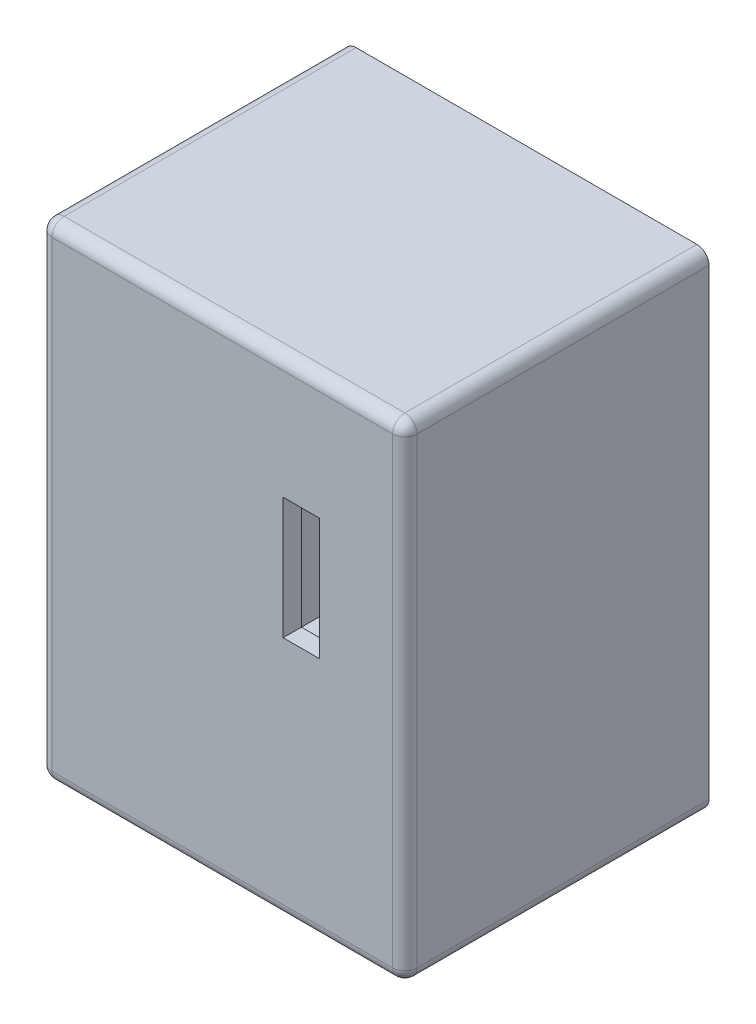
from build123d import *

# Parameters (mm, degrees)
SKETCH2_W           = 30
SKETCH2_H           = 40
BOSS_EXTRUDE2_DEPTH = 25
FILLET2_R           = 1
FILLET3_R           = 1
SHELL1_START        = 1.5
SHELL1_OUTLINE_W    = 37
SHELL1_OUTLINE_H    = 23.5
SHELL1_DEPTH        = 27
FILLET4_R           = 1
SKETCH5_W           = 3
SKETCH5_H           = 10
CUT_EXTRUDE1_DEPTH  = 56.901699437


# Read off the part's stored shape, not the designer's step: Shell1
with BuildPart() as part:
    # Sketch2 → Boss-Extrude2 (new body)
    with BuildSketch(Plane.XY):
        with Locations((15, 20)):
            Rectangle(SKETCH2_W, SKETCH2_H)
    extrude(amount=BOSS_EXTRUDE2_DEPTH)

    # Fillet2
    fillet2_edges = [part.edges().sort_by_distance(p)[0] for p in [
        (30, 20, 25),
        (15, 0, 25),
        (0, 20, 25),
        (15, 40, 25),
    ]]
    fillet(fillet2_edges, radius=FILLET2_R)

    # Fillet3
    # the kernel refuses this fillet: 1 mm, written as the material it takes off along each edge
    with BuildSketch(Plane(origin=(1, 39, 24), x_dir=(0, 1, 0), z_dir=(-1, 0, 0))) as fillet3_piece_1_section:
        Polygon((0, 0), (FILLET3_R, 0), (FILLET3_R, -FILLET3_R), (0, -FILLET3_R), align=None)
    fillet3_piece_1 = extrude(amount=FILLET3_R, mode=Mode.PRIVATE)
    fillet3_piece_1 = fillet3_piece_1 - Plane(origin=(1, 39, 24), x_dir=(0, -0.7071067811865475, -0.7071067811865475), z_dir=(-1, 0, 0)) * Sphere(FILLET3_R, mode=Mode.PRIVATE)
    add(fillet3_piece_1, mode=Mode.SUBTRACT)
    with BuildSketch(Plane(origin=(29, 39, 24), x_dir=(0, 1, 0), z_dir=(1, 0, 0))) as fillet3_piece_2_section:
        Polygon((0, 0), (FILLET3_R, 0), (FILLET3_R, FILLET3_R), (0, FILLET3_R), align=None)
    fillet3_piece_2 = extrude(amount=FILLET3_R, mode=Mode.PRIVATE)
    fillet3_piece_2 = fillet3_piece_2 - Plane(origin=(29, 39, 24), x_dir=(0, -0.7071067811865475, -0.7071067811865475), z_dir=(1, 0, 0)) * Sphere(FILLET3_R, mode=Mode.PRIVATE)
    add(fillet3_piece_2, mode=Mode.SUBTRACT)
    with BuildSketch(Plane(origin=(1, 1, 24), x_dir=(-1, 0, 0), z_dir=(0, -1, 0))) as fillet3_piece_3_section:
        Polygon((0, 0), (FILLET3_R, 0), (FILLET3_R, -FILLET3_R), (0, -FILLET3_R), align=None)
    fillet3_piece_3 = extrude(amount=FILLET3_R, mode=Mode.PRIVATE)
    fillet3_piece_3 = fillet3_piece_3 - Plane(origin=(1, 1, 24), x_dir=(0.7071067811865475, 0, -0.7071067811865475), z_dir=(0, -1, 0)) * Sphere(FILLET3_R, mode=Mode.PRIVATE)
    add(fillet3_piece_3, mode=Mode.SUBTRACT)
    with BuildSketch(Plane(origin=(29, 1, 24), x_dir=(1, 0, 0), z_dir=(0, -1, 0))) as fillet3_piece_4_section:
        Polygon((0, 0), (FILLET3_R, 0), (FILLET3_R, FILLET3_R), (0, FILLET3_R), align=None)
    fillet3_piece_4 = extrude(amount=FILLET3_R, mode=Mode.PRIVATE)
    fillet3_piece_4 = fillet3_piece_4 - Plane(origin=(29, 1, 24), x_dir=(-0.7071067811865475, 0, -0.7071067811865475), z_dir=(0, -1, 0)) * Sphere(FILLET3_R, mode=Mode.PRIVATE)
    add(fillet3_piece_4, mode=Mode.SUBTRACT)
    with BuildSketch(Plane(origin=(30, 0, -2.5), x_dir=(-1, 0, 0), z_dir=(0, 0, 1)), Plane(origin=(30, 40, -2.5), x_dir=(0, -1, 0), z_dir=(0, 0, 1))) as fillet3_piece_5:
        with BuildLine():
            CenterArc((FILLET3_R, -FILLET3_R), FILLET3_R, 90, 90)
            Line((0, -FILLET3_R), (0, 0))
            Line((0, 0), (FILLET3_R, 0))
        make_face()
    extrude(amount=26.5, mode=Mode.SUBTRACT)
    with BuildSketch(Plane(origin=(0, 0, -2.5), x_dir=(1, 0, 0), z_dir=(0, 0, 1)), Plane(origin=(0, 40, -2.5), x_dir=(0, -1, 0), z_dir=(0, 0, 1))) as fillet3_piece_6:
        with BuildLine():
            CenterArc((FILLET3_R, FILLET3_R), FILLET3_R, 180, 90)
            Line((0, FILLET3_R), (0, 0))
            Line((0, 0), (FILLET3_R, 0))
        make_face()
    extrude(amount=26.5, mode=Mode.SUBTRACT)

    # Shell1 outline → Shell1 (cut)
    with BuildSketch(Plane.YZ.offset(SHELL1_START)):
        with Locations((20, 11.75)):
            Rectangle(SHELL1_OUTLINE_W, SHELL1_OUTLINE_H)
    extrude(amount=SHELL1_DEPTH, mode=Mode.SUBTRACT)

    # Fillet4
    fillet4_edges = [part.edges().sort_by_distance(p)[0] for p in [
        (28.5, 20, 23.5),
        (1.5, 20, 23.5),
        (15, 1.5, 23.5),
        (15, 38.5, 23.5),
    ]]
    fillet(fillet4_edges, radius=FILLET4_R)

    # Sketch5 → Cut-Extrude1 (cut, through all)
    with BuildSketch(Plane.XY.offset(25)):
        with Locations((21.5, 25)):
            Rectangle(SKETCH5_W, SKETCH5_H)
    extrude(amount=-CUT_EXTRUDE1_DEPTH, mode=Mode.SUBTRACT)


solid = part.part
